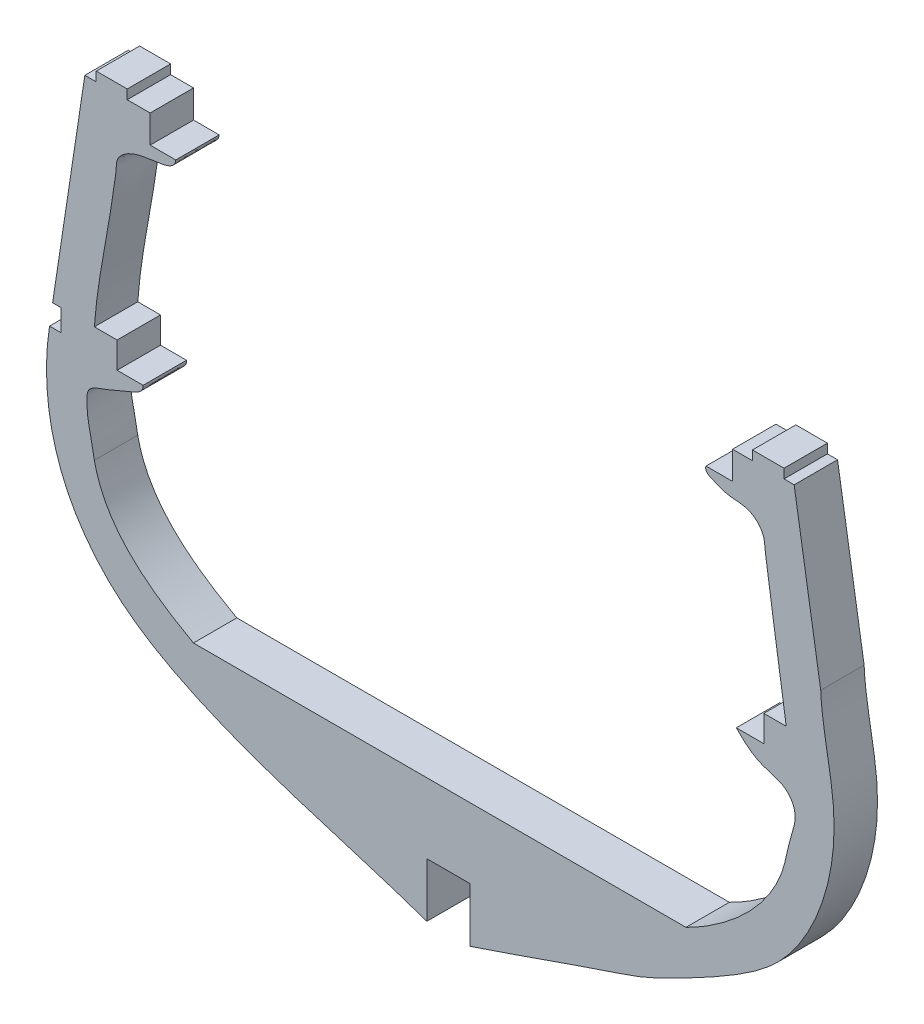
from build123d import *

# Parameters (mm, degrees)
EXTRUDE_1_DEPTH = 8


with BuildPart() as part:
    # 草图1 → 凸台-拉伸1 (new body)
    with BuildSketch(Plane.XY):
        with BuildLine():
            Line((2023.856519988, -283.355029318), (2023.856519988, -293.355029318))
            add(Edge.make_bspline(
                [(2088.462832677, -220.165546314), (2088.697911976, -226.209808272), (2091.472404984, -235.593455435), (2090.373509569, -252.155879697), (2084.018598965, -265.678637693), (2072.110942682, -274.194039322), (2053.758507174, -283.63068899), (2054.733625511, -282.52895088), (2027.119610424, -292.328562036), (2023.856519988, -293.355029318)],
                knots=[0, 0, 0, 0, 0.157381639, 0.247756685, 0.4287528, 0.514164491, 0.636986675, 0.881281265, 0.970187258, 0.970187258, 0.970187258, 0.970187258], degree=3))
            Line((2088.462832677, -220.165546314), (2083.563754054, -189.834651413))
            Line((2083.563754054, -189.834651413), (2081.700175938, -189.834651413))
            Line((2081.700175938, -189.834651413), (2081.700175938, -188.115242238))
            Line((2081.700175938, -188.115242238), (2075.876494327, -188.115242238))
            Line((2075.876494327, -188.115242238), (2075.876494327, -189.834651413))
            Line((2075.876494327, -189.834651413), (2072.207574912, -189.834651413))
            Line((2072.207574912, -189.834651413), (2072.207574912, -194.968451716))
            Line((2072.207574912, -194.968451716), (2067.315682359, -194.968451716))
            add(Edge.make_bspline(
                [(2067.315682359, -194.968451716), (2067.023941872, -195.944135533), (2069.038895662, -196.711714322), (2071.672877621, -197.823562284), (2075.457066998, -197.499762026), (2078.047033585, -200.260894613), (2078.183331374, -202.780863517), (2079.56050061, -212.114475314), (2080.833057568, -220.948784243), (2082.107833651, -229.11396078)],
                knots=[0, 0, 0, 0, 0.060523772, 0.12411076, 0.219634543, 0.316289034, 0.35532292, 0.400899314, 1, 1, 1, 1], degree=3))
            Line((2082.107833651, -229.11396078), (2077.973019707, -229.11396078))
            Line((2077.973019707, -229.11396078), (2077.973019707, -233.947616517))
            Line((2077.973019707, -233.947616517), (2072.906416705, -233.947616517))
            add(Edge.make_bspline(
                [(2063.626936852, -270.439026882), (2071.191655085, -266.698359477), (2080.745251037, -258.744909844), (2082.626945455, -246.795146777), (2084.473158964, -242.400481364), (2081.770454551, -238.335632779), (2076.979535192, -237.804327049), (2074.215270532, -235.324013435), (2072.906416705, -233.947616517)],
                knots=[0, 0, 0, 0, 0.528586857, 0.619055623, 0.732797033, 0.785421983, 0.885178905, 1, 1, 1, 1], degree=3))
            Line((2063.626936852, -270.439026882), (1972.849998168, -270.439026882))
            add(Edge.make_bspline(
                [(1972.849998168, -270.439026882), (1964.863568985, -266.012302747), (1956.610437691, -260.14413547), (1954.591465906, -250.409365983)],
                knots=[0, 0, 0, 0, 1, 1, 1, 1], degree=3))
            add(Edge.make_bspline(
                [(1963.578930876, -233.947616517), (1963.657494847, -234.835489746), (1962.239594651, -235.869254974), (1959.465421957, -236.758077146), (1956.73422556, -238.176588757), (1953.31587389, -239.136529582), (1953.017571936, -244.191069135), (1954.066163877, -247.055848625), (1954.591465906, -250.409365983)],
                knots=[0, 0, 0, 0, 0.102963072, 0.208522866, 0.386781624, 0.529425365, 0.602819093, 1, 1, 1, 1], degree=3))
            Line((1963.578930876, -233.947616517), (1958.780538562, -233.947616517))
            Line((1958.780538562, -233.947616517), (1958.780538562, -229.11396078))
            Line((1958.780538562, -229.11396078), (1954.591465906, -229.11396078))
            add(Edge.make_bspline(
                [(1969.595962509, -194.968451716), (1969.479762636, -196.269515922), (1967.431893334, -196.91890903), (1964.422036811, -197.269709964), (1961.362832557, -197.786119003), (1958.600512505, -199.771953162), (1958.662098816, -201.886854552), (1958.267996045, -204.567615679), (1956.975206145, -213.6231025), (1955.065216986, -222.168065869), (1954.591465906, -229.11396078)],
                knots=[0, 0, 0, 0, 0.07983721, 0.134651127, 0.22299695, 0.305778956, 0.343473228, 0.368850045, 0.501792392, 1, 1, 1, 1], degree=3))
            Line((1969.595962509, -194.968451716), (1964.873735152, -194.968451716))
            Line((1964.873735152, -194.968451716), (1964.873735152, -189.834651413))
            Line((1964.873735152, -189.834651413), (1960.646580017, -189.834651413))
            Line((1960.646580017, -189.834651413), (1960.646580017, -188.115242238))
            Line((1960.646580017, -188.115242238), (1954.934208214, -188.115242238))
            Line((1954.934208214, -188.115242238), (1954.934208214, -189.834651413))
            Line((1954.934208214, -189.834651413), (1952.839671886, -189.834651413))
            Line((1952.839671886, -189.834651413), (1946.898805211, -229.11396078))
            Line((1946.898805211, -229.11396078), (1948.460186837, -229.11396078))
            Line((1948.460186837, -229.11396078), (1948.460186837, -233.121747247))
            Line((1948.460186837, -233.121747247), (1946.32756803, -233.121747247))
            add(Edge.make_bspline(
                [(1946.32756803, -233.121747247), (1945.082268375, -241.031655151), (1946.382799483, -255.115805419), (1957.728251458, -270.249931154), (1980.439279121, -283.654366208), (2000.956734423, -288.121951204), (2015.872944678, -293.355029318)],
                knots=[0, 0, 0, 0, 0.235900494, 0.393498954, 0.534821476, 1, 1, 1, 1], degree=3))
            Line((2015.872944678, -293.355029318), (2015.854751423, -283.355029318))
            Line((2015.854751423, -283.355029318), (2023.856519988, -283.355029318))
        make_face()
    extrude(amount=EXTRUDE_1_DEPTH)


solid = part.part
